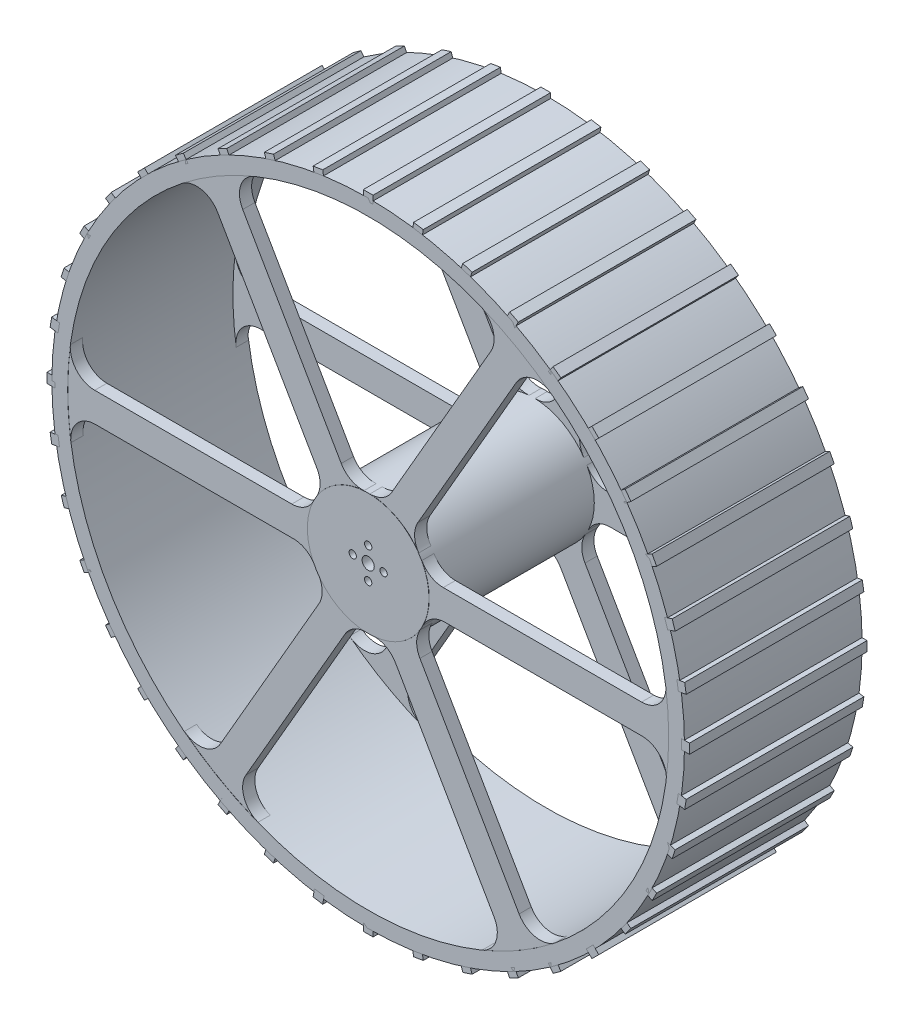
from build123d import *

# Parameters (mm, degrees)
SKETCH1_R                            = 130
SKETCH1_R_2                          = 123.5
EXTRUDE_THIN1_DEPTH                  = 36.5
SKETCH3_R                            = 25
BOSS_EXTRUDE1_DEPTH                  = 36.5
SKETCH15_R                           = 1.4986
CUT_EXTRUDE1_DEPTH                   = 73
SKETCH16_R                           = 2.499995
CUT_EXTRUDE2_DEPTH                   = 73
CIRPATTERN1_COUNT                    = 4
BOSS_EXTRUDE4_DEPTH                  = 2
BOSS_EXTRUDE4_DEPTH_BACK             = 1.27
SKETCH18_W                           = 73
SKETCH18_H                           = 4
BOSS_EXTRUDE5_REACH                  = 211.362
BOSS_EXTRUDE5_END_RADIUS             = 25
SKETCH19_W                           = 5
SKETCH19_H                           = 12
BOSS_EXTRUDE5_DIRECTION_2_REACH      = 211.362
BOSS_EXTRUDE5_DIRECTION_2_END_RADIUS = 123.5
FILLET1_R                            = 10
CIRPATTERN2_COUNT                    = 6
FILLET1_OF_CIRPATTERN2_R             = 10
MIRROR3_START                        = 31.418439822
MIRROR3_DEPTH                        = 5
CIRPATTERN3_COUNT                    = 40


# Read off the part's stored shape, not the designer's step: Mirror3
with BuildPart() as part:
    # Sketch1 → Extrude-Thin1 (new, symmetric)
    with BuildSketch(Plane.XY):
        Circle(SKETCH1_R)
        Circle(SKETCH1_R_2, mode=Mode.SUBTRACT)
    extrude(amount=EXTRUDE_THIN1_DEPTH, both=True)



with BuildPart() as body_2:
    # Sketch3 → Boss-Extrude1 (new, symmetric)
    with BuildSketch(Plane.XY):
        Circle(SKETCH3_R)
    extrude(amount=BOSS_EXTRUDE1_DEPTH, both=True)

    # Sketch15 → Cut-Extrude1 (cut)
    with BuildSketch(Plane.XY.offset(36.5)):
        with Locations((0, 6.35)):
            Circle(SKETCH15_R)
    cut_extrude1 = extrude(amount=-CUT_EXTRUDE1_DEPTH, mode=Mode.SUBTRACT)

    # Sketch16 → Cut-Extrude2 (cut)
    with BuildSketch(Plane.XY.offset(36.5)):
        Circle(SKETCH16_R)
    extrude(amount=-CUT_EXTRUDE2_DEPTH, mode=Mode.SUBTRACT)

    # CirPattern1: Cut-Extrude1 ×4 about axis
    cirpattern1_axis = Axis((0, 0, 0), (0, 0, 1))
    for i in range(1, CIRPATTERN1_COUNT):
        add(cut_extrude1.rotate(cirpattern1_axis, i * 360 / CIRPATTERN1_COUNT), mode=Mode.SUBTRACT)


with BuildPart() as body_3:
    # Sketch18 → Boss-Extrude4 (new, two sides: drawn at the far end of the back side and taken through both)
    with BuildSketch(Plane.ZY.offset(130).offset(-BOSS_EXTRUDE4_DEPTH_BACK)):
        Rectangle(SKETCH18_W, SKETCH18_H)
    extrude(amount=BOSS_EXTRUDE4_DEPTH + BOSS_EXTRUDE4_DEPTH_BACK)


with BuildPart() as part_1:
    add(part.part)

    add(body_2.part)  # Boss-Extrude5 merges body 2
    # Boss-Extrude5: up to this cylinder (the profile starts outside it)
    boss_extrude5_end = Plane(origin=(0, 0, -33.91844), z_dir=(0, 0, -1)) * Cylinder(BOSS_EXTRUDE5_END_RADIUS, 473.724, mode=Mode.PRIVATE)
    # Sketch19 → Boss-Extrude5 (add, up to the surface)
    with BuildSketch(Plane(origin=(-30, 0, 0), x_dir=(0, 0, -1), z_dir=(1, 0, 0)), mode=Mode.PRIVATE) as boss_extrude5_sk1:
        with Locations((33.918439822, -0.700352476)):
            Rectangle(SKETCH19_W, SKETCH19_H)
    boss_extrude5_tool1 = extrude(boss_extrude5_sk1.sketch, amount=BOSS_EXTRUDE5_REACH, mode=Mode.PRIVATE) - boss_extrude5_end
    boss_extrude5 = boss_extrude5_tool1.solids().sort_by_distance((-30, -0.700352, -33.91844))[0]
    add(boss_extrude5)

    # Boss-Extrude5 direction 2: up to this cylinder (the profile starts inside it)
    boss_extrude5_direction_2_end = Plane(origin=(0, 0, -33.91844), z_dir=(0, 0, -1)) * Cylinder(BOSS_EXTRUDE5_DIRECTION_2_END_RADIUS, 670.724, mode=Mode.PRIVATE)
    # Sketch19 → Boss-Extrude5 direction 2 (add, up to the surface)
    with BuildSketch(Plane(origin=(-30, 0, 0), x_dir=(0, 0, -1), z_dir=(1, 0, 0)), mode=Mode.PRIVATE) as boss_extrude5_direction_2_sk1:
        with Locations((33.918439822, -0.700352476)):
            Rectangle(SKETCH19_W, SKETCH19_H)
    boss_extrude5_direction_2_tool1 = extrude(boss_extrude5_direction_2_sk1.sketch, amount=-BOSS_EXTRUDE5_DIRECTION_2_REACH, mode=Mode.PRIVATE) & boss_extrude5_direction_2_end
    boss_extrude5_direction_2 = boss_extrude5_direction_2_tool1.solids().sort_by_distance((-30, -0.700352, -33.91844))[0]
    add(boss_extrude5_direction_2)
    boss_extrude5 = boss_extrude5 + boss_extrude5_direction_2  # both directions under the feature's name, for the pattern or mirror that repeats it

    # Fillet1
    fillet1_edges = [part_1.edges().sort_by_distance(p)[0] for p in [
        (-123.318106038, -6.700352476, -33.918439822),
        (-123.386238034, 5.299647524, -33.918439822),
        (-24.431818109, 5.299647524, -33.918439822),
        (-24.085374747, -6.700352476, -33.918439822),
    ]]
    fillet(fillet1_edges, radius=FILLET1_R)

    # CirPattern2: Boss-Extrude5 ×6 about axis
    cirpattern2_axis = Axis((0, 0, 0), (0, 0, 1))
    for i in range(1, CIRPATTERN2_COUNT):
        add(boss_extrude5.rotate(cirpattern2_axis, i * 360 / CIRPATTERN2_COUNT))

    # Fillet1 of CirPattern2
    fillet1_of_cirpattern2_edges = [part_1.edges().sort_by_distance(p)[0] for p in [
        (-55.85637756, -110.146788813, -33.918439822),
        (-66.282748403, -104.205792853, -33.918439822),
        (-16.805538441, -18.508751382, -33.918439822),
        (-6.240011914, -24.208722629, -33.918439822),
        (67.461728478, -103.446436337, -33.918439822),
        (57.10348963, -109.505440376, -33.918439822),
        (7.626279668, -23.808398905, -33.918439822),
        (17.845362832, -17.508370152, -33.918439822),
        (123.318106038, 6.700352476, -33.918439822),
        (123.386238034, -5.299647524, -33.918439822),
        (24.431818109, -5.299647524, -33.918439822),
        (24.085374747, 6.700352476, -33.918439822),
        (55.85637756, 110.146788813, -33.918439822),
        (66.282748403, 104.205792853, -33.918439822),
        (16.805538441, 18.508751382, -33.918439822),
        (6.240011914, 24.208722629, -33.918439822),
        (-67.461728478, 103.446436337, -33.918439822),
        (-57.10348963, 109.505440376, -33.918439822),
        (-7.626279668, 23.808398905, -33.918439822),
        (-17.845362832, 17.508370152, -33.918439822),
    ]]
    fillet(fillet1_of_cirpattern2_edges, radius=FILLET1_OF_CIRPATTERN2_R)

    # Mirror3 outline → Mirror3 (add)
    with BuildSketch(Plane.XY.offset(MIRROR3_START)):
        with BuildLine():
            Line((-31.478894289, 5.299647524), (-112.464086648, 5.299647524))
            ThreePointArc((-112.464086648, 5.299647524), (-119.996678024, 8.722408956), (-122.37281675, 16.64763409))
            ThreePointArc((-122.37281675, 16.64763409), (-123.497601164, -0.769744519), (-122.155792053, -18.17174917))
            ThreePointArc((-122.155792053, -18.17174917), (-119.838074144, -10.170190416), (-112.264634802, -6.700352476))
            Line((-112.264634802, -6.700352476), (-30.758709777, -6.700352476))
            ThreePointArc((-30.758709777, -6.700352476), (-25.645750399, -8.106305328), (-21.970506984, -11.928823197))
            ThreePointArc((-21.970506984, -11.928823197), (-24.993671035, -0.562501711), (-22.484924492, 10.92831966))
            ThreePointArc((-22.484924492, 10.92831966), (-26.173862651, 6.822817968), (-31.478894289, 5.299647524))
        make_face()
        with BuildLine():
            ThreePointArc((-46.76913434, 114.301785083), (-62.41541889, 106.567187655), (-76.815092439, 96.704144552))
            ThreePointArc((-76.815092439, 96.704144552), (-68.726680334, 98.697721341), (-61.93499286, 93.873849447))
            Line((-61.93499286, 93.873849447), (-21.182030348, 23.287647817))
            ThreePointArc((-21.182030348, 23.287647817), (-19.843141544, 18.156718681), (-21.315917418, 13.062605583))
            ThreePointArc((-21.315917418, 13.062605583), (-12.98397629, 21.363903195), (-1.7782598, 24.936675642))
            ThreePointArc((-1.7782598, 24.936675642), (-7.17819764, 26.078638955), (-11.149817758, 29.911345899))
            Line((-11.149817758, 29.911345899), (-51.642413938, 100.046579813))
            ThreePointArc((-51.642413938, 100.046579813), (-52.444511274, 108.281376017), (-46.76913434, 114.301785083))
        make_face()
        with BuildLine():
            ThreePointArc((-60.821672711, -94.746932289), (-67.55216675, -99.55896706), (-75.603682409, -97.654150993))
            ThreePointArc((-75.603682409, -97.654150993), (-61.082182274, -107.336932174), (-45.340699614, -114.875893722))
            ThreePointArc((-45.340699614, -114.875893722), (-51.11139381, -108.867911757), (-50.329641942, -100.574201923))
            Line((-50.329641942, -100.574201923), (-9.57667943, -29.988000293))
            ThreePointArc((-9.57667943, -29.988000293), (-5.802608855, -26.263024008), (-0.654589566, -24.991428781))
            ThreePointArc((-0.654589566, -24.991428781), (-12.009694746, -21.926404906), (-20.706664692, -14.008355982))
            ThreePointArc((-20.706664692, -14.008355982), (-18.995665011, -19.255820987), (-20.329076531, -24.611698375))
            Line((-20.329076531, -24.611698375), (-60.821672711, -94.746932289))
        make_face()
        with BuildLine():
            ThreePointArc((75.603682409, 97.654150993), (61.082182274, 107.336932174), (45.340699614, 114.875893722))
            ThreePointArc((45.340699614, 114.875893722), (51.11139381, 108.867911757), (50.329641942, 100.574201923))
            Line((50.329641942, 100.574201923), (9.57667943, 29.988000293))
            ThreePointArc((9.57667943, 29.988000293), (5.802608855, 26.263024008), (0.654589566, 24.991428781))
            ThreePointArc((0.654589566, 24.991428781), (12.009694746, 21.926404906), (20.706664692, 14.008355982))
            ThreePointArc((20.706664692, 14.008355982), (18.995665011, 19.255820987), (20.329076531, 24.611698375))
            Line((20.329076531, 24.611698375), (60.821672711, 94.746932289))
            ThreePointArc((60.821672711, 94.746932289), (67.55216675, 99.55896706), (75.603682409, 97.654150993))
        make_face()
        with BuildLine():
            ThreePointArc((51.642413938, -100.046579813), (52.444511274, -108.281376017), (46.76913434, -114.301785083))
            ThreePointArc((46.76913434, -114.301785083), (62.41541889, -106.567187655), (76.815092439, -96.704144552))
            ThreePointArc((76.815092439, -96.704144552), (68.726680334, -98.697721341), (61.93499286, -93.873849447))
            Line((61.93499286, -93.873849447), (21.182030348, -23.287647817))
            ThreePointArc((21.182030348, -23.287647817), (19.843141544, -18.156718681), (21.315917418, -13.062605583))
            ThreePointArc((21.315917418, -13.062605583), (12.98397629, -21.363903195), (1.7782598, -24.936675642))
            ThreePointArc((1.7782598, -24.936675642), (7.17819764, -26.078638955), (11.149817758, -29.911345899))
            Line((11.149817758, -29.911345899), (51.642413938, -100.046579813))
        make_face()
        with BuildLine():
            ThreePointArc((122.37281675, -16.64763409), (123.497601164, 0.769744519), (122.155792053, 18.17174917))
            ThreePointArc((122.155792053, 18.17174917), (119.838074144, 10.170190416), (112.264634802, 6.700352476))
            Line((112.264634802, 6.700352476), (30.758709777, 6.700352476))
            ThreePointArc((30.758709777, 6.700352476), (25.645750399, 8.106305328), (21.970506984, 11.928823197))
            ThreePointArc((21.970506984, 11.928823197), (24.993671035, 0.562501711), (22.484924492, -10.92831966))
            ThreePointArc((22.484924492, -10.92831966), (26.173862651, -6.822817968), (31.478894289, -5.299647524))
            Line((31.478894289, -5.299647524), (112.464086648, -5.299647524))
            ThreePointArc((112.464086648, -5.299647524), (119.996678024, -8.722408956), (122.37281675, -16.64763409))
        make_face()
    extrude(amount=MIRROR3_DEPTH)


with BuildPart() as cirpattern3_1:
    # CirPattern3: pattern copy
    add(body_3.part.rotate(Axis((0, 0, 0), (0, 0, 1)), 1 * 360 / CIRPATTERN3_COUNT))


with BuildPart() as cirpattern3_2:
    # CirPattern3: pattern copy
    add(body_3.part.rotate(Axis((0, 0, 0), (0, 0, 1)), 2 * 360 / CIRPATTERN3_COUNT))


with BuildPart() as cirpattern3_3:
    # CirPattern3: pattern copy
    add(body_3.part.rotate(Axis((0, 0, 0), (0, 0, 1)), 3 * 360 / CIRPATTERN3_COUNT))


with BuildPart() as cirpattern3_4:
    # CirPattern3: pattern copy
    add(body_3.part.rotate(Axis((0, 0, 0), (0, 0, 1)), 4 * 360 / CIRPATTERN3_COUNT))


with BuildPart() as cirpattern3_5:
    # CirPattern3: pattern copy
    add(body_3.part.rotate(Axis((0, 0, 0), (0, 0, 1)), 5 * 360 / CIRPATTERN3_COUNT))


with BuildPart() as cirpattern3_6:
    # CirPattern3: pattern copy
    add(body_3.part.rotate(Axis((0, 0, 0), (0, 0, 1)), 6 * 360 / CIRPATTERN3_COUNT))


with BuildPart() as cirpattern3_7:
    # CirPattern3: pattern copy
    add(body_3.part.rotate(Axis((0, 0, 0), (0, 0, 1)), 7 * 360 / CIRPATTERN3_COUNT))


with BuildPart() as cirpattern3_8:
    # CirPattern3: pattern copy
    add(body_3.part.rotate(Axis((0, 0, 0), (0, 0, 1)), 8 * 360 / CIRPATTERN3_COUNT))


with BuildPart() as cirpattern3_9:
    # CirPattern3: pattern copy
    add(body_3.part.rotate(Axis((0, 0, 0), (0, 0, 1)), 9 * 360 / CIRPATTERN3_COUNT))


with BuildPart() as cirpattern3_10:
    # CirPattern3: pattern copy
    add(body_3.part.rotate(Axis((0, 0, 0), (0, 0, 1)), 10 * 360 / CIRPATTERN3_COUNT))


with BuildPart() as cirpattern3_11:
    # CirPattern3: pattern copy
    add(body_3.part.rotate(Axis((0, 0, 0), (0, 0, 1)), 11 * 360 / CIRPATTERN3_COUNT))


with BuildPart() as cirpattern3_12:
    # CirPattern3: pattern copy
    add(body_3.part.rotate(Axis((0, 0, 0), (0, 0, 1)), 12 * 360 / CIRPATTERN3_COUNT))


with BuildPart() as cirpattern3_13:
    # CirPattern3: pattern copy
    add(body_3.part.rotate(Axis((0, 0, 0), (0, 0, 1)), 13 * 360 / CIRPATTERN3_COUNT))


with BuildPart() as cirpattern3_14:
    # CirPattern3: pattern copy
    add(body_3.part.rotate(Axis((0, 0, 0), (0, 0, 1)), 14 * 360 / CIRPATTERN3_COUNT))


with BuildPart() as cirpattern3_15:
    # CirPattern3: pattern copy
    add(body_3.part.rotate(Axis((0, 0, 0), (0, 0, 1)), 15 * 360 / CIRPATTERN3_COUNT))


with BuildPart() as cirpattern3_16:
    # CirPattern3: pattern copy
    add(body_3.part.rotate(Axis((0, 0, 0), (0, 0, 1)), 16 * 360 / CIRPATTERN3_COUNT))


with BuildPart() as cirpattern3_17:
    # CirPattern3: pattern copy
    add(body_3.part.rotate(Axis((0, 0, 0), (0, 0, 1)), 17 * 360 / CIRPATTERN3_COUNT))


with BuildPart() as cirpattern3_18:
    # CirPattern3: pattern copy
    add(body_3.part.rotate(Axis((0, 0, 0), (0, 0, 1)), 18 * 360 / CIRPATTERN3_COUNT))


with BuildPart() as cirpattern3_19:
    # CirPattern3: pattern copy
    add(body_3.part.rotate(Axis((0, 0, 0), (0, 0, 1)), 19 * 360 / CIRPATTERN3_COUNT))


with BuildPart() as cirpattern3_20:
    # CirPattern3: pattern copy
    add(body_3.part.rotate(Axis((0, 0, 0), (0, 0, 1)), 20 * 360 / CIRPATTERN3_COUNT))


with BuildPart() as cirpattern3_21:
    # CirPattern3: pattern copy
    add(body_3.part.rotate(Axis((0, 0, 0), (0, 0, 1)), 21 * 360 / CIRPATTERN3_COUNT))


with BuildPart() as cirpattern3_22:
    # CirPattern3: pattern copy
    add(body_3.part.rotate(Axis((0, 0, 0), (0, 0, 1)), 22 * 360 / CIRPATTERN3_COUNT))


with BuildPart() as cirpattern3_23:
    # CirPattern3: pattern copy
    add(body_3.part.rotate(Axis((0, 0, 0), (0, 0, 1)), 23 * 360 / CIRPATTERN3_COUNT))


with BuildPart() as cirpattern3_24:
    # CirPattern3: pattern copy
    add(body_3.part.rotate(Axis((0, 0, 0), (0, 0, 1)), 24 * 360 / CIRPATTERN3_COUNT))


with BuildPart() as cirpattern3_25:
    # CirPattern3: pattern copy
    add(body_3.part.rotate(Axis((0, 0, 0), (0, 0, 1)), 25 * 360 / CIRPATTERN3_COUNT))


with BuildPart() as cirpattern3_26:
    # CirPattern3: pattern copy
    add(body_3.part.rotate(Axis((0, 0, 0), (0, 0, 1)), 26 * 360 / CIRPATTERN3_COUNT))


with BuildPart() as cirpattern3_27:
    # CirPattern3: pattern copy
    add(body_3.part.rotate(Axis((0, 0, 0), (0, 0, 1)), 27 * 360 / CIRPATTERN3_COUNT))


with BuildPart() as cirpattern3_28:
    # CirPattern3: pattern copy
    add(body_3.part.rotate(Axis((0, 0, 0), (0, 0, 1)), 28 * 360 / CIRPATTERN3_COUNT))


with BuildPart() as cirpattern3_29:
    # CirPattern3: pattern copy
    add(body_3.part.rotate(Axis((0, 0, 0), (0, 0, 1)), 29 * 360 / CIRPATTERN3_COUNT))


with BuildPart() as cirpattern3_30:
    # CirPattern3: pattern copy
    add(body_3.part.rotate(Axis((0, 0, 0), (0, 0, 1)), 30 * 360 / CIRPATTERN3_COUNT))


with BuildPart() as cirpattern3_31:
    # CirPattern3: pattern copy
    add(body_3.part.rotate(Axis((0, 0, 0), (0, 0, 1)), 31 * 360 / CIRPATTERN3_COUNT))


with BuildPart() as cirpattern3_32:
    # CirPattern3: pattern copy
    add(body_3.part.rotate(Axis((0, 0, 0), (0, 0, 1)), 32 * 360 / CIRPATTERN3_COUNT))


with BuildPart() as cirpattern3_33:
    # CirPattern3: pattern copy
    add(body_3.part.rotate(Axis((0, 0, 0), (0, 0, 1)), 33 * 360 / CIRPATTERN3_COUNT))


with BuildPart() as cirpattern3_34:
    # CirPattern3: pattern copy
    add(body_3.part.rotate(Axis((0, 0, 0), (0, 0, 1)), 34 * 360 / CIRPATTERN3_COUNT))


with BuildPart() as cirpattern3_35:
    # CirPattern3: pattern copy
    add(body_3.part.rotate(Axis((0, 0, 0), (0, 0, 1)), 35 * 360 / CIRPATTERN3_COUNT))


with BuildPart() as cirpattern3_36:
    # CirPattern3: pattern copy
    add(body_3.part.rotate(Axis((0, 0, 0), (0, 0, 1)), 36 * 360 / CIRPATTERN3_COUNT))


with BuildPart() as cirpattern3_37:
    # CirPattern3: pattern copy
    add(body_3.part.rotate(Axis((0, 0, 0), (0, 0, 1)), 37 * 360 / CIRPATTERN3_COUNT))


with BuildPart() as cirpattern3_38:
    # CirPattern3: pattern copy
    add(body_3.part.rotate(Axis((0, 0, 0), (0, 0, 1)), 38 * 360 / CIRPATTERN3_COUNT))


with BuildPart() as cirpattern3_39:
    # CirPattern3: pattern copy
    add(body_3.part.rotate(Axis((0, 0, 0), (0, 0, 1)), 39 * 360 / CIRPATTERN3_COUNT))


solid = Compound([body_3.part, part_1.part, cirpattern3_1.part, cirpattern3_2.part, cirpattern3_3.part, cirpattern3_4.part, cirpattern3_5.part, cirpattern3_6.part, cirpattern3_7.part, cirpattern3_8.part, cirpattern3_9.part, cirpattern3_10.part, cirpattern3_11.part, cirpattern3_12.part, cirpattern3_13.part, cirpattern3_14.part, cirpattern3_15.part, cirpattern3_16.part, cirpattern3_17.part, cirpattern3_18.part, cirpattern3_19.part, cirpattern3_20.part, cirpattern3_21.part, cirpattern3_22.part, cirpattern3_23.part, cirpattern3_24.part, cirpattern3_25.part, cirpattern3_26.part, cirpattern3_27.part, cirpattern3_28.part, cirpattern3_29.part, cirpattern3_30.part, cirpattern3_31.part, cirpattern3_32.part, cirpattern3_33.part, cirpattern3_34.part, cirpattern3_35.part, cirpattern3_36.part, cirpattern3_37.part, cirpattern3_38.part, cirpattern3_39.part])
